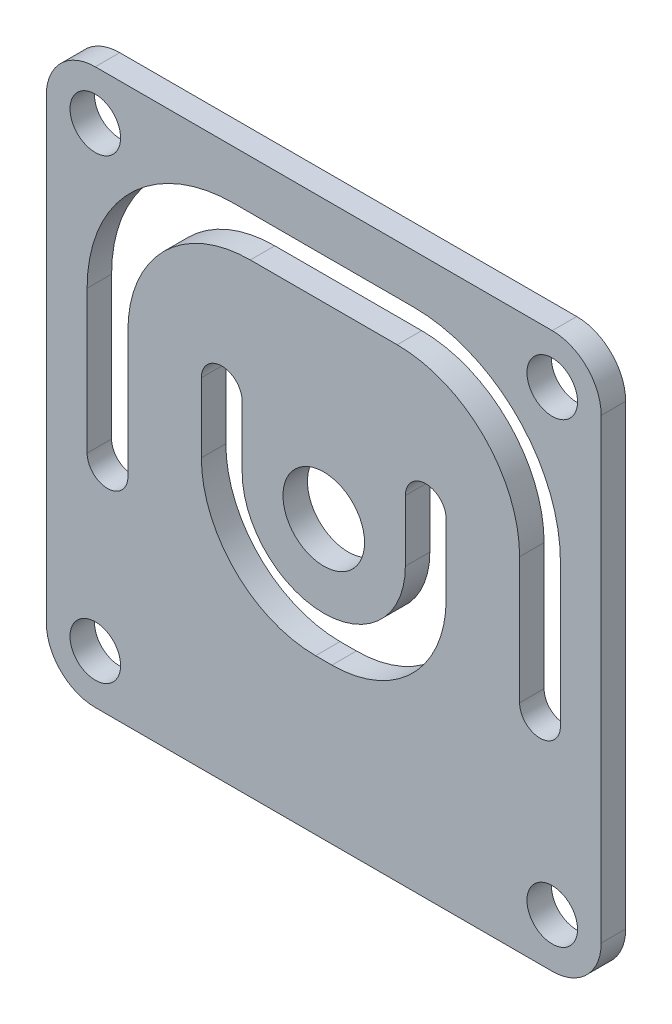
from build123d import *

# Parameters (mm, degrees)
SKETCH_1_W             = 34
SKETCH_1_H             = 34
EXTRUDE_1_DEPTH        = 1.5
SKETCH_2_R             = 2.5
SKETCH_2_R_2           = 1.55
CUT_EXTRUDE_1_DEPTH    = 49.106652347
SKETCH_3_R             = 1.25
CUT_EXTRUDE_2_DEPTH    = 49.106652347
CUT_EXTRUDE_3_DEPTH    = 49.106652347
FILLET_1_R             = 1.25
FILLET_1_OF_MIRROR_3_R = 1.25
FILLET_2_R             = 3


with BuildPart() as part:
    # ｽｹｯﾁ1 → ﾎﾞｽ - 押し出し1 (new body)
    with BuildSketch(Plane.XY):
        with Locations((17, 17)):
            Rectangle(SKETCH_1_W, SKETCH_1_H)
    extrude(amount=EXTRUDE_1_DEPTH)

    # ｽｹｯﾁ2 → ｶｯﾄ - 押し出し1 (cut, through all)
    with BuildSketch(Plane.XY.offset(1.5)):
        with Locations((17, 17)):
            Circle(SKETCH_2_R)
        with Locations((3, 31)):
            Circle(SKETCH_2_R_2)
        with Locations((31, 31)):
            Circle(SKETCH_2_R_2)
        with Locations((3, 3)):
            Circle(SKETCH_2_R_2)
        with Locations((31, 3)):
            Circle(SKETCH_2_R_2)
    extrude(amount=-CUT_EXTRUDE_1_DEPTH, mode=Mode.SUBTRACT)

    # ｽｹｯﾁ3 → ｶｯﾄ - 押し出し2 (cut, through all)
    with BuildSketch(Plane.XY.offset(1.5)):
        with BuildLine():
            Line((2.5, 22), (2.5, 13.25))
            ThreePointArc((2.5, 13.25), (3.75, 14.5), (5, 13.25))
            Line((5, 13.25), (5, 21))
            ThreePointArc((5, 21), (7.196699141, 26.303300859), (12.5, 28.5))
            Line((12.5, 28.5), (17, 28.5))
            Line((17, 28.5), (17, 31))
            Line((17, 31), (11.5, 31))
            ThreePointArc((11.5, 31), (5.136038969, 28.363961031), (2.5, 22))
        make_face()
        with Locations((3.75, 13.25)):
            Circle(SKETCH_3_R)
    cut_extrude_2 = extrude(amount=-CUT_EXTRUDE_2_DEPTH, mode=Mode.SUBTRACT)

    # ﾐﾗｰ1: ｶｯﾄ - 押し出し2 across plane
    add(cut_extrude_2.mirror(Plane(origin=(17, 0, 0), x_dir=(0, 0, 1), z_dir=(1, 0, 0))), mode=Mode.SUBTRACT)

    # ｽｹｯﾁ4 → ｶｯﾄ - 押し出し3 (cut, through all)
    with BuildSketch(Plane.XY.offset(1.5)):
        with BuildLine():
            ThreePointArc((17, 12), (13.464466094, 13.464466094), (12, 17))
            Line((12, 17), (12, 22))
            Line((12, 22), (9.5, 22))
            Line((9.5, 22), (9.5, 16.5))
            ThreePointArc((9.5, 16.5), (11.550252532, 11.550252532), (16.5, 9.5))
            Line((16.5, 9.5), (17, 9.5))
            Line((17, 9.5), (17, 12))
        make_face()
    cut_extrude_3 = extrude(amount=-CUT_EXTRUDE_3_DEPTH, mode=Mode.SUBTRACT)

    # ﾌｨﾚｯﾄ1
    fillet_1_edges = [part.edges().sort_by_distance(p)[0] for p in [
        (12, 22, 0.75),
        (9.5, 22, 0.75),
    ]]
    fillet(fillet_1_edges, radius=FILLET_1_R - 0.0001)  # a hair under: the kernel refuses the full size

    # ﾐﾗｰ3: ｶｯﾄ - 押し出し3 across plane
    add(cut_extrude_3.mirror(Plane(origin=(17, 0, 0), x_dir=(0, 0, 1), z_dir=(1, 0, 0))), mode=Mode.SUBTRACT)

    # ﾌｨﾚｯﾄ1 of ﾐﾗｰ3
    fillet_1_of_mirror_3_edges = [part.edges().sort_by_distance(p)[0] for p in [
        (22, 22, 0.75),
        (24.5, 22, 0.75),
    ]]
    fillet(fillet_1_of_mirror_3_edges, radius=FILLET_1_OF_MIRROR_3_R - 0.0001)  # a hair under: the kernel refuses the full size

    # ﾌｨﾚｯﾄ2
    fillet_2_edges = [part.edges().sort_by_distance(p)[0] for p in [
        (0, 34, 0.75),
        (34, 34, 0.75),
        (34, 0, 0.75),
        (0, 0, 0.75),
    ]]
    fillet(fillet_2_edges, radius=FILLET_2_R)


solid = part.part
